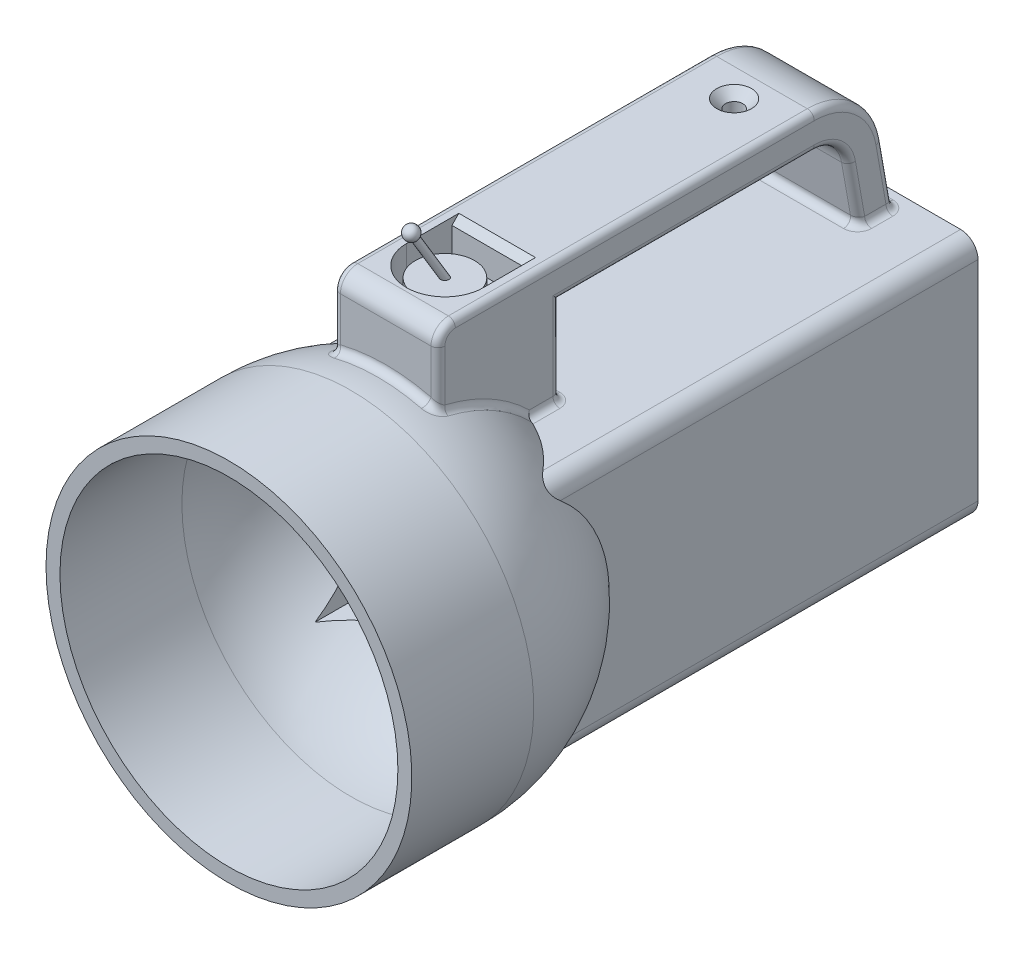
from build123d import *

# Parameters (mm, degrees)
SKETCH1_W                                       = 70
SKETCH1_H                                       = 70
BOSS_EXTRUDE2_DEPTH                             = 180
SHELL1_START                                    = 4
SHELL1_OUTLINE_W                                = 62
SHELL1_OUTLINE_H                                = 62
SHELL1_DEPTH                                    = 176
SHELL1_START_2                                  = 144.9999999
SHELL1_2_OUTLINE_R                              = 48.5
SHELL1_2_OUTLINE_W                              = 62
SHELL1_2_OUTLINE_H                              = 62
SHELL1_2_DEPTH                                  = 35.0000001
FILLET1_R                                       = 5
BOSS_EXTRUDE3_DEPTH                             = 15
BOSS_EXTRUDE4_REACH                             = 220.661
SKETCH7_W                                       = 30
SKETCH7_H                                       = 35
CSK_FOR_M2_FLAT_HEAD_MACHINE_SCREW1_D           = 5
CSK_FOR_M2_FLAT_HEAD_MACHINE_SCREW1_DEPTH       = 10
CSK_FOR_M2_FLAT_HEAD_MACHINE_SCREW1_CSINK_D     = 10
CSK_FOR_M2_FLAT_HEAD_MACHINE_SCREW1_CSINK_ANGLE = 90
CUT_EXTRUDE1_DEPTH                              = 10
SKETCH14_R                                      = 8.5
BOSS_EXTRUDE5_DEPTH                             = 7
FILLET2_R                                       = 5
FILLET3_R                                       = 2
CHAMFER1_SIZE                                   = 2
RIB6_REACH                                      = 194.024
SKETCH22_WALLS_W                                = 448.048174062
SKETCH22_WALLS_H                                = 3
RIB6_DRAFT_ANGLE                                = 10


with BuildPart() as part:
    # Sketch1 → Boss-Extrude2 (new body)
    with BuildSketch(Plane.XY):
        Rectangle(SKETCH1_W, SKETCH1_H)
    extrude(amount=BOSS_EXTRUDE2_DEPTH)

    # Sketch4 → Revolve3 (revolve)
    with BuildSketch(Plane(origin=(0, 0, 0), x_dir=(1, 0, 0), z_dir=(0, 1, 0))):
        with BuildLine():
            Line((-52.5, -145), (-52.5, -180))
            Line((-52.5, -180), (0, -180))
            Line((0, -180), (0, -92.5))
            ThreePointArc((0, -92.5), (-37.123106012, -107.876893988), (-52.5, -145))
        make_face()
    revolve(axis=Axis((0, 0, -34.561258659), (0, 0, 1)))

    # Shell1: read off the stored shape, not the designer's step
    # Shell1 outline → Shell1 (cut)
    with BuildSketch(Plane.XY.offset(SHELL1_START)):
        Rectangle(SHELL1_OUTLINE_W, SHELL1_OUTLINE_H)
    extrude(amount=SHELL1_DEPTH, mode=Mode.SUBTRACT)

    # Shell1 2 outline → Shell1 2 (cut)
    with BuildSketch(Plane.XY.offset(SHELL1_START_2)):
        Circle(SHELL1_2_OUTLINE_R)
        Rectangle(SHELL1_2_OUTLINE_W, SHELL1_2_OUTLINE_H, mode=Mode.SUBTRACT)
    extrude(amount=SHELL1_2_DEPTH, mode=Mode.SUBTRACT)

    # Shell1 3 outline → Shell1 3 (revolve, cut)
    with BuildSketch(Plane.XZ):
        with BuildLine():
            Line((30.999999963, 145.000000049), (30.999999963, 107.700536166))
            ThreePointArc((30.999999963, 107.700536166), (43.907573379, 124.399635926), (48.5, 145.000000049))
            Line((48.5, 145.000000049), (30.999999963, 145.000000049))
        make_face()
    revolve(axis=Axis((0, 0, 0), (0, 0, 1)), mode=Mode.SUBTRACT)

    # Fillet1
    fillet1_edges = [part.edges().sort_by_distance(p)[0] for p in [
        (-35, 35, 63.75),
        (35, 35, 63.75),
        (35, -35, 63.75),
        (-35, -35, 63.75),
    ]]
    fillet(fillet1_edges, radius=FILLET1_R)

    # Sketch6 → Boss-Extrude3 (add, symmetric)
    with BuildSketch(Plane(origin=(0, 0, 0), x_dir=(0, 0, -1), z_dir=(1, 0, 0))):
        with BuildLine():
            Line((-135, 70), (-135, 60))
            Line((-135, 60), (-100, 60))
            Line((-100, 60), (-27, 60))
            ThreePointArc((-27, 60), (-20.572123903, 57.660444431), (-17.15192247, 51.736481777))
            Line((-17.15192247, 51.736481777), (-14.200829171, 35))
            Line((-14.200829171, 35), (-4.046563052, 35))
            Line((-4.046563052, 35), (-7.30384494, 53.472963553))
            ThreePointArc((-7.30384494, 53.472963553), (-14.144247806, 65.320888862), (-27, 70))
            Line((-27, 70), (-100, 70))
            Line((-100, 70), (-135, 70))
        make_face()
    extrude(amount=BOSS_EXTRUDE3_DEPTH, both=True)

    # Sketch7 → Boss-Extrude4 (add, up to next)
    with BuildSketch(Plane.XZ.offset(-60), mode=Mode.PRIVATE) as boss_extrude4_sk1:
        with Locations((0, 117.5)):
            Rectangle(SKETCH7_W, SKETCH7_H)
    boss_extrude4_tool1 = extrude(boss_extrude4_sk1.sketch, amount=BOSS_EXTRUDE4_REACH, mode=Mode.PRIVATE) - part.part
    add(boss_extrude4_tool1.solids().sort_by_distance((0, 60, 117.5))[0])

    # CSK for M2 Flat Head Machine Screw1
    with Locations(Plane(origin=(0, 70, 0), x_dir=(1, 0, 0), z_dir=(0, 1, 0))):
        with Locations((0, -35)):
            CounterSinkHole(CSK_FOR_M2_FLAT_HEAD_MACHINE_SCREW1_D / 2, CSK_FOR_M2_FLAT_HEAD_MACHINE_SCREW1_CSINK_D / 2, depth=CSK_FOR_M2_FLAT_HEAD_MACHINE_SCREW1_DEPTH, counter_sink_angle=CSK_FOR_M2_FLAT_HEAD_MACHINE_SCREW1_CSINK_ANGLE)

    # Sketch13 → Cut-Extrude1 (cut)
    with BuildSketch(Plane(origin=(0, 70, 0), x_dir=(1, 0, 0), z_dir=(0, 1, 0))):
        with BuildLine():
            Line((-11, -105), (11, -105))
            Line((11, -105), (11, -118))
            ThreePointArc((11, -118), (0, -129), (-11, -118))
            Line((-11, -118), (-11, -105))
        make_face()
    extrude(amount=-CUT_EXTRUDE1_DEPTH, mode=Mode.SUBTRACT)

    # Sketch14 → Boss-Extrude5 (add)
    with BuildSketch(Plane(origin=(0, 60, 0), x_dir=(1, 0, 0), z_dir=(0, 1, 0))):
        with Locations(Location((0, -118, 0), (0, 0, 270))):
            Circle(SKETCH14_R)
    extrude(amount=BOSS_EXTRUDE5_DEPTH)

    # Fillet2
    fillet2_edges = [part.edges().sort_by_distance(p)[0] for p in [
        (0, 70, 135),
    ]]
    fillet(fillet2_edges, radius=FILLET2_R)

    # Fillet3
    fillet3_edges = [part.edges().sort_by_distance(p)[0] for p in [
        (-15, 57.153853654, 135),
        (15, 57.153853654, 135),
        (-15, 68.535533906, 133.535533906),
        (15, 68.535533906, 133.535533906),
        (-15, 57.660444431, 20.572123903),
        (-15, 43.368240888, 15.67637582),
        (-15, 35, 9.123696111),
        (0, 35, 14.200829171),
        (-15, 44.236481777, 5.675203996),
        (0, 35, 4.046563052),
        (-15, 65.320888862, 14.144247806),
        (-15, 70, 78.5),
        (15, 70, 78.5),
        (15, 57.660444431, 20.572123903),
        (15, 43.368240888, 15.67637582),
        (15, 35, 9.123696111),
        (15, 44.236481777, 5.675203996),
        (15, 65.320888862, 14.144247806),
        (-15, 60, 63.5),
        (15, 60, 63.5),
        (-15, 35, 104.428959631),
        (0, 35, 100),
        (15, 35, 104.428959631),
        (-15, 47.5, 100),
        (0, 51.53882032, 135),
        (15, 44.13388125, 120.845279431),
        (15, 47.5, 100),
        (-15, 44.13388125, 120.845279431),
    ]]
    fillet(fillet3_edges, radius=FILLET3_R)

    # Chamfer1
    chamfer1_edges = [part.edges().sort_by_distance(p)[0] for p in [
        (0, 70, 105),
    ]]
    chamfer(chamfer1_edges, length=CHAMFER1_SIZE)

    # Sketch18 → Revolve4 (revolve)
    with BuildSketch(Plane(origin=(55.441864626, 0, 38.820811544), x_dir=(0.5735764363510469, 0, -0.8191520442889911), z_dir=(0.8191520442889911, 0, 0.5735764363510469))):
        with BuildLine():
            Line((-101.856093649, 78), (-95.505240688, 67))
            Line((-95.505240688, 67), (-96.659941226, 67))
            Line((-96.659941226, 67), (-104.588144456, 80.732050808))
            ThreePointArc((-104.588144456, 80.732050808), (-102.173930894, 80.414213562), (-101.856093649, 78))
        make_face()
    revolve(axis=Axis((0, 67, 118), (-0.2867882181755263, 0.866025403784436, 0.40957602214449923)))

    # Sketch22 walls → Rib6 (add, up to next)
    with BuildSketch(Plane.XY.offset(14), mode=Mode.PRIVATE) as rib6_sk1:
        with Locations((0, 17.5)):
            Rectangle(SKETCH22_WALLS_W, SKETCH22_WALLS_H)
    rib6_tool1 = extrude(rib6_sk1.sketch, amount=-RIB6_REACH, mode=Mode.PRIVATE) - part.part
    # Sketch22 walls → Rib6 (add, up to next)
    with BuildSketch(Plane.XY.offset(14), mode=Mode.PRIVATE) as rib6_sk2:
        with Locations((0, -17.5)):
            Rectangle(SKETCH22_WALLS_W, SKETCH22_WALLS_H)
    rib6_tool2 = extrude(rib6_sk2.sketch, amount=-RIB6_REACH, mode=Mode.PRIVATE) - part.part
    add(rib6_tool1.solids().sort_by_distance((0, 17.5, 14))[0])
    add(rib6_tool2.solids().sort_by_distance((0, -17.5, 14))[0])

    # Rib6 draft
    rib6_draft_faces = [part.faces().sort_by_distance(p)[0] for p in [
        (0, 19, 13.5),
        (0, 16, 13.5),
        (0, -16, 13.5),
        (0, -19, 13.5),
    ]]
    draft(rib6_draft_faces, Plane(origin=(0, 17.5, 14), x_dir=(1, 0, 0), z_dir=(0, 0, 1)), RIB6_DRAFT_ANGLE)


solid = part.part
